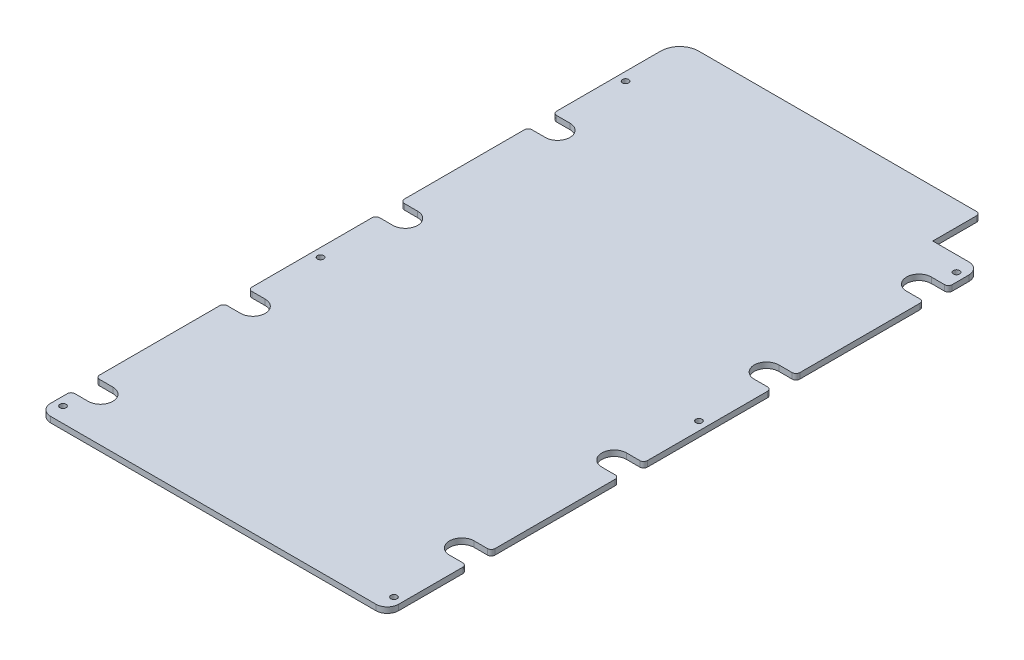
from build123d import *

# Parameters (mm, degrees)
BOSS_EXTRUDE1_DEPTH       = 3
FILLET1_R                 = 10
FILLET2_R                 = 6
F_4_CLEARANCE_HOLE1_D     = 3.2639
F_4_CLEARANCE_HOLE1_DEPTH = 3
F_4_CLEARANCE_HOLE1_TIP   = 0.980574487
FILLET3_R                 = 2


with BuildPart() as part:
    # Sketch1 → Boss-Extrude1 (new body)
    with BuildSketch(Plane(origin=(0, 0, 0), x_dir=(1, 0, 0), z_dir=(0, 1, 0))):
        with BuildLine():
            Line((-91.65, 34.109827366), (-82.65, 34.109827366))
            ThreePointArc((-82.65, 34.109827366), (-76.15, 27.609827366), (-82.65, 21.109827366))
            Line((-82.65, 21.109827366), (-91.65, 21.109827366))
            Line((-91.65, 21.109827366), (-91.65, -46.140172634))
            Line((-91.65, -46.140172634), (-82.65, -46.140172634))
            ThreePointArc((-82.65, -46.140172634), (-76.15, -52.640172634), (-82.65, -59.140172634))
            Line((-82.65, -59.140172634), (-91.65, -59.140172634))
            Line((-91.65, -59.140172634), (-91.65, -126.390172634))
            Line((-91.65, -126.390172634), (-82.65, -126.390172634))
            ThreePointArc((-82.65, -126.390172634), (-76.15, -132.890172634), (-82.65, -139.390172634))
            Line((-82.65, -139.390172634), (-91.65, -139.390172634))
            Line((-91.65, -139.390172634), (-91.65, -156.140172634))
            Line((-91.65, -156.140172634), (91.65, -156.140172634))
            Line((91.65, -156.140172634), (91.65, -114.390172634))
            Line((91.65, -114.390172634), (82.65, -114.390172634))
            ThreePointArc((82.65, -114.390172634), (76.15, -107.890172634), (82.65, -101.390172634))
            Line((82.65, -101.390172634), (91.65, -101.390172634))
            Line((91.65, -101.390172634), (91.65, -34.140172634))
            Line((91.65, -34.140172634), (82.65, -34.140172634))
            ThreePointArc((82.65, -34.140172634), (76.15, -27.640172634), (82.65, -21.140172634))
            Line((82.65, -21.140172634), (91.65, -21.140172634))
            Line((91.65, -21.140172634), (91.65, 46.109827366))
            Line((91.65, 46.109827366), (82.65, 46.109827366))
            ThreePointArc((82.65, 46.109827366), (76.15, 52.609827366), (82.65, 59.109827366))
            Line((82.65, 59.109827366), (91.65, 59.109827366))
            Line((91.65, 59.109827366), (91.65, 126.359827366))
            Line((91.65, 126.359827366), (82.65, 126.359827366))
            ThreePointArc((82.65, 126.359827366), (76.15, 132.859827366), (82.65, 139.359827366))
            Line((82.65, 139.359827366), (91.65, 139.359827366))
            Line((91.65, 139.359827366), (91.65, 156.140172634))
            Line((91.65, 156.140172634), (66.65, 156.140172634))
            Line((66.65, 156.140172634), (66.65, 181.140172634))
            Line((66.65, 181.140172634), (-91.65, 181.140172634))
            Line((-91.65, 181.140172634), (-91.65, 114.359827366))
            Line((-91.65, 114.359827366), (-82.65, 114.359827366))
            ThreePointArc((-82.65, 114.359827366), (-76.15, 107.859827366), (-82.65, 101.359827366))
            Line((-82.65, 101.359827366), (-91.65, 101.359827366))
            Line((-91.65, 101.359827366), (-91.65, 34.109827366))
        make_face()
    extrude(amount=BOSS_EXTRUDE1_DEPTH)

    # Fillet1
    fillet1_edges = [part.edges().sort_by_distance(p)[0] for p in [
        (-91.65, 1.5, -181.140172634),
    ]]
    fillet(fillet1_edges, radius=FILLET1_R)

    # Fillet2
    fillet2_edges = [part.edges().sort_by_distance(p)[0] for p in [
        (91.65, 1.5, 156.140172634),
        (-91.65, 1.5, 156.140172634),
        (91.65, 1.5, -156.140172634),
    ]]
    fillet(fillet2_edges, radius=FILLET2_R)

    # #4 Clearance Hole1
    with Locations(Plane(origin=(0, 3, 0), x_dir=(1, 0, 0), z_dir=(0, 1, 0))):
        with Locations((87.15, 148.140172634), (-87.15, -148.140172634), (-87.15, -12.515172634), (-87.15, 148.140172634), (87.15, 12.484827366), (87.15, -148.140172634)):
            Hole(F_4_CLEARANCE_HOLE1_D / 2, depth=F_4_CLEARANCE_HOLE1_DEPTH)
            with Locations((0, 0, -(F_4_CLEARANCE_HOLE1_DEPTH + F_4_CLEARANCE_HOLE1_TIP / 2))):  # 118° drill point
                Cone(0, F_4_CLEARANCE_HOLE1_D / 2, F_4_CLEARANCE_HOLE1_TIP, mode=Mode.SUBTRACT)

    # Fillet3
    fillet3_edges = [part.edges().sort_by_distance(p)[0] for p in [
        (-91.65, 1.5, -101.359827366),
        (-91.65, 1.5, -114.359827366),
        (-91.65, 1.5, -21.109827366),
        (-91.65, 1.5, -34.109827366),
        (-91.65, 1.5, 59.140172634),
        (-91.65, 1.5, 46.140172634),
        (-91.65, 1.5, 139.390172634),
        (-91.65, 1.5, 126.390172634),
        (91.65, 1.5, 101.390172634),
        (91.65, 1.5, 114.390172634),
        (91.65, 1.5, 34.140172634),
        (91.65, 1.5, 21.140172634),
        (91.65, 1.5, -46.109827366),
        (91.65, 1.5, -59.109827366),
        (91.65, 1.5, -126.359827366),
        (91.65, 1.5, -139.359827366),
        (66.65, 1.5, -181.140172634),
    ]]
    fillet(fillet3_edges, radius=FILLET3_R)


solid = part.part
